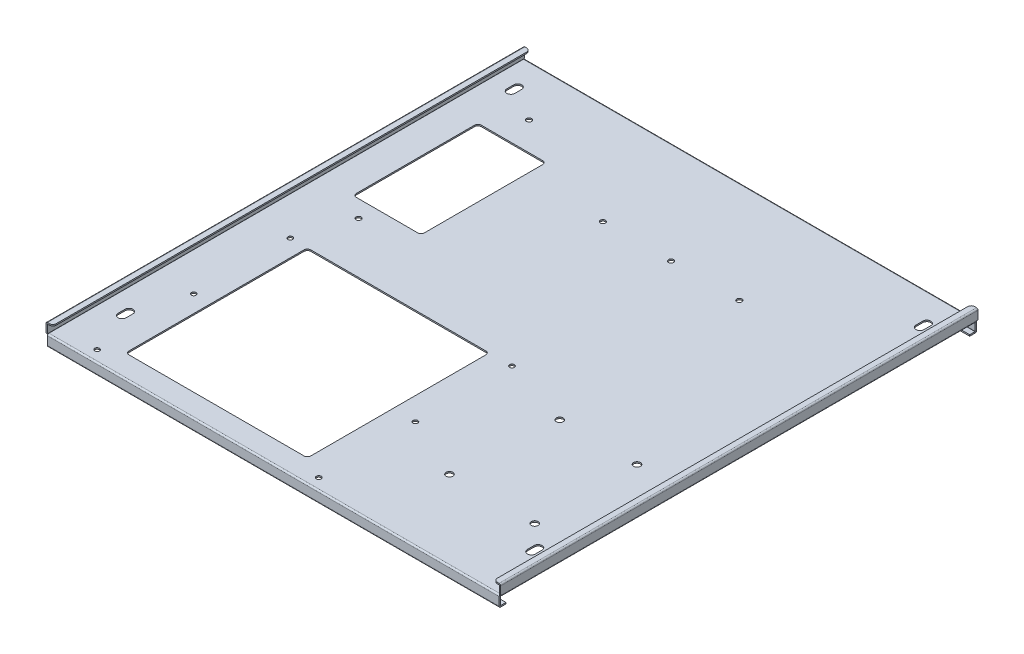
from build123d import *

# Parameters (mm, degrees)
SKETCH_1_W                         = 400
SKETCH_1_H                         = 420
SM_BASE_FLANGE_1_DEPTH             = 1.2
SM_EDGE_FLANGE_1_STRIP_W           = 5
SM_EDGE_FLANGE_1_STRIP_H           = 1.2
SM_EDGE_FLANGE_1_STRIP_CUT_DEPTH   = 420
SM_EDGE_FLANGE_1_STRIP_2_W         = 5
SM_EDGE_FLANGE_1_STRIP_2_H         = 1.2
SM_EDGE_FLANGE_1_STRIP_CUT_2_DEPTH = 420
SM_EDGE_FLANGE_1_DEPTH             = 420
SM_EDGE_FLANGE_1_BEND_DEPTH        = 420
SM_EDGE_FLANGE_2_STRIP_W           = 5
SM_EDGE_FLANGE_2_STRIP_H           = 1.2
SM_EDGE_FLANGE_2_STRIP_CUT_DEPTH   = 420
SM_EDGE_FLANGE_2_STRIP_2_W         = 5
SM_EDGE_FLANGE_2_STRIP_2_H         = 1.2
SM_EDGE_FLANGE_2_STRIP_CUT_2_DEPTH = 420
SM_EDGE_FLANGE_2_DEPTH             = 420
SM_EDGE_FLANGE_2_BEND_DEPTH        = 420
SM_START                           = -200
SM_EDGE_FLANGE_3_DEPTH             = 400
SM_EDGE_FLANGE_3_2_DEPTH           = 1.3
SM_START_2                         = 198.7
SM_EDGE_FLANGE_3_3_DEPTH           = 1.3
SM_START_3                         = -198.7
SM_EDGE_FLANGE_3_4_DEPTH           = 397.4
SM_EDGE_FLANGE_4_STRIP_W           = 5
SM_EDGE_FLANGE_4_STRIP_H           = 1.2
SM_EDGE_FLANGE_4_STRIP_CUT_DEPTH   = 397.4
SM_EDGE_FLANGE_4_STRIP_2_W         = 5
SM_EDGE_FLANGE_4_STRIP_2_H         = 1.2
SM_EDGE_FLANGE_4_STRIP_CUT_2_DEPTH = 397.4
SM_EDGE_FLANGE_4_DEPTH             = 397.4
SM_EDGE_FLANGE_4_BEND_DEPTH        = 397.4
FILLET_1_R                         = 3
SKETCH_40_R                        = 2.25
CUT_EXTRUDE_2_DEPTH                = 10
SKETCH_45_R                        = 1.5
CUT_EXTRUDE_3_DEPTH                = 3
SKETCH_48_R                        = 2.25
CUT_EXTRUDE_6_DEPTH                = 10
SKETCH_50_W                        = 60
SKETCH_50_H                        = 110
CUT_EXTRUDE_7_DEPTH                = 10
SKETCH_52_W                        = 160
SKETCH_52_H                        = 160
CUT_EXTRUDE_10_DEPTH               = 10
FILLET_2_R                         = 3
FILLET_4_R                         = 3
SKETCH_54_R                        = 2.1
SKETCH_54_R_2                      = 1.5
EXTRUDE_1_DEPTH                    = 5
EXTRUDE_1_2_DEPTH                  = 5
EXTRUDE_1_3_DEPTH                  = 5
EXTRUDE_1_4_DEPTH                  = 5
EXTRUDE_1_5_DEPTH                  = 5
EXTRUDE_1_6_DEPTH                  = 5
CUT_EXTRUDE_11_DEPTH               = 5
SKETCH_56_R                        = 3
CUT_EXTRUDE_12_DEPTH               = 10
M3_DR_BY                           = 0.6
M3_DR_1_BY                         = 0.6
M3_DR_2_BY                         = 0.6
M3_DR_3_BY                         = 0.6
M3_DR_4_START                      = -1.2
M3_DR_4_OUTLINE_R                  = 2.1
M3_DR_4_OUTLINE_R_2                = 1.5
M3_DR_4_DEPTH                      = 1.2
M3_DR_5_START                      = -1.2
M3_DR_5_OUTLINE_R                  = 2.1
M3_DR_5_OUTLINE_R_2                = 1.5
M3_DR_5_DEPTH                      = 1.2


# Read off the part's stored shape, not the designer's step: 边线-法兰3, 压铆螺母柱【M3】_Dr底孔4, 压铆螺母柱【M3】_Dr底孔5
# Sheet-metal steps are written as plain solids
with BuildPart() as part:
    # Sketch 1 → 基体-法兰1 (new body)
    with BuildSketch(Plane(origin=(0, 0, 0), x_dir=(1, 0, 0), z_dir=(0, 1, 0))):
        Rectangle(SKETCH_1_W, SKETCH_1_H)
    extrude(amount=-SM_BASE_FLANGE_1_DEPTH)

    # 边线-法兰1 strip (across the edge) → 边线-法兰1 strip cut (cut)
    with BuildSketch(Plane(origin=(-200, 0, -210), x_dir=(1, 0, 0), z_dir=(0, 0, 1))):
        with Locations((-1.2, -0.6)):
            Rectangle(SM_EDGE_FLANGE_1_STRIP_W, SM_EDGE_FLANGE_1_STRIP_H)
    extrude(amount=SM_EDGE_FLANGE_1_STRIP_CUT_DEPTH, mode=Mode.SUBTRACT)

    # 边线-法兰1 strip 2 (across the edge) → 边线-法兰1 strip cut 2 (cut)
    with BuildSketch(Plane(origin=(200, 0, 210), x_dir=(-1, 0, 0), z_dir=(0, 0, -1))):
        with Locations((-1.2, -0.6)):
            Rectangle(SM_EDGE_FLANGE_1_STRIP_2_W, SM_EDGE_FLANGE_1_STRIP_2_H)
    extrude(amount=SM_EDGE_FLANGE_1_STRIP_CUT_2_DEPTH, mode=Mode.SUBTRACT)

    # 边线-法兰1 section (across the edge) → 边线-法兰1 (add)
    with BuildSketch(Plane(origin=(-200, 0, -210), x_dir=(1, 0, 0), z_dir=(0, 0, 1))):
        with BuildLine():
            Line((0, 0.1), (0, 8.8))
            Line((0, 8.8), (1.2, 8.8))
            Line((1.2, 8.8), (1.2, 0.1))
            ThreePointArc((1.2, 0.1), (1.229289322, 0.029289322), (1.3, 0))
            Line((1.3, 0), (1.3, -1.2))
            ThreePointArc((1.3, -1.2), (0.380761184, -0.819238816), (0, 0.1))
        make_face()
    extrude(amount=SM_EDGE_FLANGE_1_DEPTH)

    # 边线-法兰1 section 2 (across the edge) → 边线-法兰1 bend (add)
    with BuildSketch(Plane(origin=(200, 0, 210), x_dir=(-1, 0, 0), z_dir=(0, 0, -1))):
        with BuildLine():
            Line((0, 0.1), (0, 8.8))
            Line((0, 8.8), (1.2, 8.8))
            Line((1.2, 8.8), (1.2, 0.1))
            ThreePointArc((1.2, 0.1), (1.229289322, 0.029289322), (1.3, 0))
            Line((1.3, 0), (1.3, -1.2))
            ThreePointArc((1.3, -1.2), (0.380761184, -0.819238816), (0, 0.1))
        make_face()
    extrude(amount=SM_EDGE_FLANGE_1_BEND_DEPTH)

    # 边线-法兰2 strip (across the edge) → 边线-法兰2 strip cut (cut)
    with BuildSketch(Plane(origin=(-198.8, 8.8, -210), x_dir=(0, -1, 0), z_dir=(0, 0, 1))):
        with Locations((-1.2, -0.6)):
            Rectangle(SM_EDGE_FLANGE_2_STRIP_W, SM_EDGE_FLANGE_2_STRIP_H)
    extrude(amount=SM_EDGE_FLANGE_2_STRIP_CUT_DEPTH, mode=Mode.SUBTRACT)

    # 边线-法兰2 strip 2 (across the edge) → 边线-法兰2 strip cut 2 (cut)
    with BuildSketch(Plane(origin=(198.8, 8.8, 210), x_dir=(0, -1, 0), z_dir=(0, 0, -1))):
        with Locations((-1.2, -0.6)):
            Rectangle(SM_EDGE_FLANGE_2_STRIP_2_W, SM_EDGE_FLANGE_2_STRIP_2_H)
    extrude(amount=SM_EDGE_FLANGE_2_STRIP_CUT_2_DEPTH, mode=Mode.SUBTRACT)

    # 边线-法兰2 section (across the edge) → 边线-法兰2 (add)
    with BuildSketch(Plane(origin=(-198.8, 8.8, -210), x_dir=(0, -1, 0), z_dir=(0, 0, 1))):
        with BuildLine():
            Line((0, 0.1), (0, 4.8))
            Line((0, 4.8), (1.2, 4.8))
            Line((1.2, 4.8), (1.2, 0.1))
            ThreePointArc((1.2, 0.1), (1.229289322, 0.029289322), (1.3, 0))
            Line((1.3, 0), (1.3, -1.2))
            ThreePointArc((1.3, -1.2), (0.380761184, -0.819238816), (0, 0.1))
        make_face()
    extrude(amount=SM_EDGE_FLANGE_2_DEPTH)

    # 边线-法兰2 section 2 (across the edge) → 边线-法兰2 bend (add)
    with BuildSketch(Plane(origin=(198.8, 8.8, 210), x_dir=(0, -1, 0), z_dir=(0, 0, -1))):
        with BuildLine():
            Line((0, 0.1), (0, 4.8))
            Line((0, 4.8), (1.2, 4.8))
            Line((1.2, 4.8), (1.2, 0.1))
            ThreePointArc((1.2, 0.1), (1.229289322, 0.029289322), (1.3, 0))
            Line((1.3, 0), (1.3, -1.2))
            ThreePointArc((1.3, -1.2), (0.380761184, -0.819238816), (0, 0.1))
        make_face()
    extrude(amount=SM_EDGE_FLANGE_2_BEND_DEPTH)

    # 边线-法兰3 outline → 边线-法兰3 (cut)
    with BuildSketch(Plane.YZ.offset(SM_START)):
        with BuildLine():
            Line((0.1, -210), (0.1, -208.7))
            Line((0.1, -208.7), (0, -208.7))
            ThreePointArc((0, -208.7), (-0.346060798, -209.583176087), (-1.2, -209.99614814))
            Line((-1.2, -209.99614814), (-1.2, -210))
            Line((-1.2, -210), (0.1, -210))
        make_face()
        with BuildLine():
            Line((0.1, 210), (-1.2, 210))
            Line((-1.2, 210), (-1.2, 209.99614814))
            ThreePointArc((-1.2, 209.99614814), (-0.346060798, 209.583176087), (0, 208.7))
            Line((0, 208.7), (0.1, 208.7))
            Line((0.1, 208.7), (0.1, 210))
        make_face()
    extrude(amount=SM_EDGE_FLANGE_3_DEPTH, mode=Mode.SUBTRACT)

    # Sm Edge Flange 3 2 outline → Sm Edge Flange 3 2 (cut)
    with BuildSketch(Plane.YZ.offset(SM_START)):
        with BuildLine():
            ThreePointArc((-1.2, -209.99614814), (-0.346060798, -209.583176087), (0, -208.7))
            Line((0, -208.7), (-1.2, -208.7))
            Line((-1.2, -208.7), (-1.2, -209.99614814))
        make_face()
        with BuildLine():
            Line((-1.2, 208.7), (0, 208.7))
            ThreePointArc((0, 208.7), (-0.346060798, 209.583176087), (-1.2, 209.99614814))
            Line((-1.2, 209.99614814), (-1.2, 208.7))
        make_face()
    extrude(amount=SM_EDGE_FLANGE_3_2_DEPTH, mode=Mode.SUBTRACT)

    # Sm Edge Flange 3 3 outline → Sm Edge Flange 3 3 (cut)
    with BuildSketch(Plane.YZ.offset(SM_START_2)):
        with BuildLine():
            ThreePointArc((-1.2, -209.99614814), (-0.346060798, -209.583176087), (0, -208.7))
            Line((0, -208.7), (-1.2, -208.7))
            Line((-1.2, -208.7), (-1.2, -209.99614814))
        make_face()
        with BuildLine():
            Line((-1.2, 208.7), (0, 208.7))
            ThreePointArc((0, 208.7), (-0.346060798, 209.583176087), (-1.2, 209.99614814))
            Line((-1.2, 209.99614814), (-1.2, 208.7))
        make_face()
    extrude(amount=SM_EDGE_FLANGE_3_3_DEPTH, mode=Mode.SUBTRACT)

    # Sm Edge Flange 3 4 outline → Sm Edge Flange 3 4 (add)
    with BuildSketch(Plane.YZ.offset(SM_START_3)):
        with BuildLine():
            Line((-1.2, -209.99614814), (-1.2, -208.7))
            ThreePointArc((-1.2, -208.7), (-1.229289322, -208.770710678), (-1.3, -208.8))
            Line((-1.3, -208.8), (-10, -208.8))
            Line((-10, -208.8), (-10, -210))
            Line((-10, -210), (-1.3, -210))
            ThreePointArc((-1.3, -210), (-1.249962922, -209.999036678), (-1.2, -209.99614814))
        make_face()
        with BuildLine():
            ThreePointArc((-1.3, 208.8), (-1.229289322, 208.770710678), (-1.2, 208.7))
            Line((-1.2, 208.7), (-1.2, 209.99614814))
            ThreePointArc((-1.2, 209.99614814), (-1.249962922, 209.999036678), (-1.3, 210))
            Line((-1.3, 210), (-10, 210))
            Line((-10, 210), (-10, 208.8))
            Line((-10, 208.8), (-1.3, 208.8))
        make_face()
    extrude(amount=SM_EDGE_FLANGE_3_4_DEPTH)

    # 边线-法兰4 strip (across the edge) → 边线-法兰4 strip cut (cut)
    with BuildSketch(Plane(origin=(-198.7, -10, -208.8), x_dir=(0, 1, 0), z_dir=(1, 0, 0))):
        with Locations((-1.2, -0.6)):
            Rectangle(SM_EDGE_FLANGE_4_STRIP_W, SM_EDGE_FLANGE_4_STRIP_H)
    extrude(amount=SM_EDGE_FLANGE_4_STRIP_CUT_DEPTH, mode=Mode.SUBTRACT)

    # 边线-法兰4 strip 2 (across the edge) → 边线-法兰4 strip cut 2 (cut)
    with BuildSketch(Plane(origin=(198.7, -10, 208.8), x_dir=(0, 1, 0), z_dir=(-1, 0, 0))):
        with Locations((-1.2, -0.6)):
            Rectangle(SM_EDGE_FLANGE_4_STRIP_2_W, SM_EDGE_FLANGE_4_STRIP_2_H)
    extrude(amount=SM_EDGE_FLANGE_4_STRIP_CUT_2_DEPTH, mode=Mode.SUBTRACT)

    # 边线-法兰4 section (across the edge) → 边线-法兰4 (add)
    with BuildSketch(Plane(origin=(-198.7, -10, -208.8), x_dir=(0, 1, 0), z_dir=(1, 0, 0))):
        with BuildLine():
            Line((0, 0.1), (0, 4.8))
            Line((0, 4.8), (1.2, 4.8))
            Line((1.2, 4.8), (1.2, 0.1))
            ThreePointArc((1.2, 0.1), (1.229289322, 0.029289322), (1.3, 0))
            Line((1.3, 0), (1.3, -1.2))
            ThreePointArc((1.3, -1.2), (0.380761184, -0.819238816), (0, 0.1))
        make_face()
    extrude(amount=SM_EDGE_FLANGE_4_DEPTH)

    # 边线-法兰4 section 2 (across the edge) → 边线-法兰4 bend (add)
    with BuildSketch(Plane(origin=(198.7, -10, 208.8), x_dir=(0, 1, 0), z_dir=(-1, 0, 0))):
        with BuildLine():
            Line((0, 0.1), (0, 4.8))
            Line((0, 4.8), (1.2, 4.8))
            Line((1.2, 4.8), (1.2, 0.1))
            ThreePointArc((1.2, 0.1), (1.229289322, 0.029289322), (1.3, 0))
            Line((1.3, 0), (1.3, -1.2))
            ThreePointArc((1.3, -1.2), (0.380761184, -0.819238816), (0, 0.1))
        make_face()
    extrude(amount=SM_EDGE_FLANGE_4_BEND_DEPTH)

    # 圆角1
    fillet_1_edges = [part.edges().sort_by_distance(p)[0] for p in [
        (-194, 8.2, -210),
        (-194, 8.2, 210),
        (194, 8.2, 210),
        (194, 8.2, -210),
    ]]
    fillet(fillet_1_edges, radius=FILLET_1_R)

    # 草图40 → 切除-拉伸2 (cut)
    with BuildSketch(Plane(origin=(0, 0, 0), x_dir=(1, 0, 0), z_dir=(0, 1, 0))):
        with Locations(Location((-40, 120, 0), (0, 0, 270))):
            Circle(SKETCH_40_R)
        with Locations(Location((20, 120, 0), (0, 0, 270))):
            Circle(SKETCH_40_R)
        with Locations(Location((80, 120, 0), (0, 0, 270))):
            Circle(SKETCH_40_R)
    extrude(amount=-CUT_EXTRUDE_2_DEPTH, mode=Mode.SUBTRACT)

    # 草图45 → 切除-拉伸3 (cut)
    with BuildSketch(Plane(origin=(0, 0, 0), x_dir=(1, 0, 0), z_dir=(0, 1, 0))):
        with Locations(Location((-165, -30, 0), (0, 0, 270))):
            Circle(SKETCH_45_R)
        with Locations(Location((30, -200, 0), (0, 0, 270))):
            Circle(SKETCH_45_R)
        with Locations(Location((-165, -200, 0), (0, 0, 270))):
            Circle(SKETCH_45_R)
        with Locations(Location((30, -30, 0), (0, 0, 270))):
            Circle(SKETCH_45_R)
        with Locations(Location((-165, -115, 0), (0, 0, 270))):
            Circle(SKETCH_45_R)
        with Locations(Location((30, -115, 0), (0, 0, 270))):
            Circle(SKETCH_45_R)
    extrude(amount=-CUT_EXTRUDE_3_DEPTH, mode=Mode.SUBTRACT)

    # 草图48 → 切除-拉伸6 (cut)
    with BuildSketch(Plane(origin=(0, 0, 0), x_dir=(1, 0, 0), z_dir=(0, 1, 0))):
        with Locations(Location((-150, 165, 0), (0, 0, 270))):
            Circle(SKETCH_48_R)
        with Locations(Location((-150, 15, 0), (0, 0, 270))):
            Circle(SKETCH_48_R)
    extrude(amount=-CUT_EXTRUDE_6_DEPTH, mode=Mode.SUBTRACT)

    # 草图50 → 切除-拉伸7 (cut)
    with BuildSketch(Plane(origin=(0, 0, 0), x_dir=(1, 0, 0), z_dir=(0, 1, 0))):
        with Locations((-140, 85)):
            Rectangle(SKETCH_50_W, SKETCH_50_H)
    extrude(amount=-CUT_EXTRUDE_7_DEPTH, mode=Mode.SUBTRACT)

    # 草图52 → 切除-拉伸10 (cut)
    with BuildSketch(Plane(origin=(0, 0, 0), x_dir=(1, 0, 0), z_dir=(0, 1, 0))):
        with Locations((-70, -110)):
            Rectangle(SKETCH_52_W, SKETCH_52_H)
    extrude(amount=-CUT_EXTRUDE_10_DEPTH, mode=Mode.SUBTRACT)

    # 圆角2
    fillet_2_edges = [part.edges().sort_by_distance(p)[0] for p in [
        (-170, -0.6, -30),
        (-170, -0.6, -140),
        (-110, -0.6, -140),
        (-110, -0.6, -30),
    ]]
    fillet(fillet_2_edges, radius=FILLET_2_R)

    # 圆角4
    fillet_4_edges = [part.edges().sort_by_distance(p)[0] for p in [
        (-150, -0.6, 190),
        (-150, -0.6, 30),
        (10, -0.6, 30),
        (10, -0.6, 190),
    ]]
    fillet(fillet_4_edges, radius=FILLET_4_R)

    # 草图55 → 切除-拉伸11 (cut)
    with BuildSketch(Plane(origin=(0, 0, 0), x_dir=(1, 0, 0), z_dir=(0, 1, 0))):
        with BuildLine():
            Line((176.5, -163), (176.5, -157))
            ThreePointArc((176.5, -157), (180, -153.5), (183.5, -157))
            Line((183.5, -157), (183.5, -163))
            ThreePointArc((183.5, -163), (180, -166.5), (176.5, -163))
        make_face()
        with BuildLine():
            Line((176.5, 179), (176.5, 185))
            ThreePointArc((176.5, 185), (180, 188.5), (183.5, 185))
            Line((183.5, 185), (183.5, 179))
            ThreePointArc((183.5, 179), (180, 175.5), (176.5, 179))
        make_face()
        with BuildLine():
            Line((-176.5, 179), (-176.5, 185))
            ThreePointArc((-176.5, 185), (-180, 188.5), (-183.5, 185))
            Line((-183.5, 185), (-183.5, 179))
            ThreePointArc((-183.5, 179), (-180, 175.5), (-176.5, 179))
        make_face()
        with BuildLine():
            Line((-176.5, -163), (-176.5, -157))
            ThreePointArc((-176.5, -157), (-180, -153.5), (-183.5, -157))
            Line((-183.5, -157), (-183.5, -163))
            ThreePointArc((-183.5, -163), (-180, -166.5), (-176.5, -163))
        make_face()
    extrude(amount=-CUT_EXTRUDE_11_DEPTH, mode=Mode.SUBTRACT)

    # 草图56 → 切除-拉伸12 (cut)
    with BuildSketch(Plane(origin=(0, 0, 0), x_dir=(1, 0, 0), z_dir=(0, 1, 0))):
        with Locations(Location((160, -50, 0), (0, 0, 270))):
            Circle(SKETCH_56_R)
        with Locations(Location((92, -50, 0), (0, 0, 270))):
            Circle(SKETCH_56_R)
        with Locations(Location((160, -140, 0), (0, 0, 270))):
            Circle(SKETCH_56_R)
        with Locations(Location((85, -140, 0), (0, 0, 270))):
            Circle(SKETCH_56_R)
    extrude(amount=-CUT_EXTRUDE_12_DEPTH, mode=Mode.SUBTRACT)

    # 压铆螺母柱【M3】_Dr底孔: a curved face moved inward by 0.6
    add(Solid.thicken(part.faces().sort_by_distance((-165, -0.6, 198.5))[0], -M3_DR_BY), mode=Mode.SUBTRACT)

    # 压铆螺母柱【M3】_Dr底孔1: a curved face moved inward by 0.6
    add(Solid.thicken(part.faces().sort_by_distance((-165, -0.6, 113.5))[0], -M3_DR_1_BY), mode=Mode.SUBTRACT)

    # 压铆螺母柱【M3】_Dr底孔2: a curved face moved inward by 0.6
    add(Solid.thicken(part.faces().sort_by_distance((30, -0.6, 198.5))[0], -M3_DR_2_BY), mode=Mode.SUBTRACT)

    # 压铆螺母柱【M3】_Dr底孔3: a curved face moved inward by 0.6
    add(Solid.thicken(part.faces().sort_by_distance((-165, -0.6, 28.5))[0], -M3_DR_3_BY), mode=Mode.SUBTRACT)

    # 压铆螺母柱【M3】_Dr底孔4 outline → 压铆螺母柱【M3】_Dr底孔4 (cut)
    with BuildSketch(Plane(origin=(0, 0, 0), x_dir=(1, 0, 0), z_dir=(0, 1, 0)).offset(M3_DR_4_START)):
        with Locations((30, -115)):
            Circle(M3_DR_4_OUTLINE_R)
        with Locations((30, -115)):
            Circle(M3_DR_4_OUTLINE_R_2, mode=Mode.SUBTRACT)
    extrude(amount=M3_DR_4_DEPTH, mode=Mode.SUBTRACT)

    # 压铆螺母柱【M3】_Dr底孔5 outline → 压铆螺母柱【M3】_Dr底孔5 (cut)
    with BuildSketch(Plane(origin=(0, 0, 0), x_dir=(1, 0, 0), z_dir=(0, 1, 0)).offset(M3_DR_5_START)):
        with Locations((30, -30)):
            Circle(M3_DR_5_OUTLINE_R)
        with Locations((30, -30)):
            Circle(M3_DR_5_OUTLINE_R_2, mode=Mode.SUBTRACT)
    extrude(amount=M3_DR_5_DEPTH, mode=Mode.SUBTRACT)


with BuildPart() as body_2:
    # 草图54 → 凸台-拉伸1 (new body)
    with BuildSketch(Plane(origin=(0, 0, 0), x_dir=(1, 0, 0), z_dir=(0, 1, 0))):
        with Locations(Location((30, -30, 0), (0, 0, 270))):
            Circle(SKETCH_54_R)
        with Locations(Location((30, -30, 0), (0, 0, 270))):
            Circle(SKETCH_54_R_2, mode=Mode.SUBTRACT)
    extrude(amount=EXTRUDE_1_DEPTH)


with BuildPart() as body_3:
    # 草图54 → Extrude 1 2 (new body)
    with BuildSketch(Plane(origin=(0, 0, 0), x_dir=(1, 0, 0), z_dir=(0, 1, 0))):
        with Locations(Location((-165, -30, 0), (0, 0, 270))):
            Circle(SKETCH_54_R)
        with Locations(Location((-165, -30, 0), (0, 0, 270))):
            Circle(SKETCH_54_R_2, mode=Mode.SUBTRACT)
    extrude(amount=EXTRUDE_1_2_DEPTH)


with BuildPart() as body_4:
    # 草图54 → Extrude 1 3 (new body)
    with BuildSketch(Plane(origin=(0, 0, 0), x_dir=(1, 0, 0), z_dir=(0, 1, 0))):
        with Locations(Location((-165, -115, 0), (0, 0, 270))):
            Circle(SKETCH_54_R)
        with Locations(Location((-165, -115, 0), (0, 0, 270))):
            Circle(SKETCH_54_R_2, mode=Mode.SUBTRACT)
    extrude(amount=EXTRUDE_1_3_DEPTH)


with BuildPart() as body_5:
    # 草图54 → Extrude 1 4 (new body)
    with BuildSketch(Plane(origin=(0, 0, 0), x_dir=(1, 0, 0), z_dir=(0, 1, 0))):
        with Locations(Location((-165, -200, 0), (0, 0, 270))):
            Circle(SKETCH_54_R)
        with Locations(Location((-165, -200, 0), (0, 0, 270))):
            Circle(SKETCH_54_R_2, mode=Mode.SUBTRACT)
    extrude(amount=EXTRUDE_1_4_DEPTH)


with BuildPart() as body_6:
    # 草图54 → Extrude 1 5 (new body)
    with BuildSketch(Plane(origin=(0, 0, 0), x_dir=(1, 0, 0), z_dir=(0, 1, 0))):
        with Locations(Location((30, -115, 0), (0, 0, 270))):
            Circle(SKETCH_54_R)
        with Locations(Location((30, -115, 0), (0, 0, 270))):
            Circle(SKETCH_54_R_2, mode=Mode.SUBTRACT)
    extrude(amount=EXTRUDE_1_5_DEPTH)


with BuildPart() as body_7:
    # 草图54 → Extrude 1 6 (new body)
    with BuildSketch(Plane(origin=(0, 0, 0), x_dir=(1, 0, 0), z_dir=(0, 1, 0))):
        with Locations(Location((30, -200, 0), (0, 0, 270))):
            Circle(SKETCH_54_R)
        with Locations(Location((30, -200, 0), (0, 0, 270))):
            Circle(SKETCH_54_R_2, mode=Mode.SUBTRACT)
    extrude(amount=EXTRUDE_1_6_DEPTH)


solid = part.part
